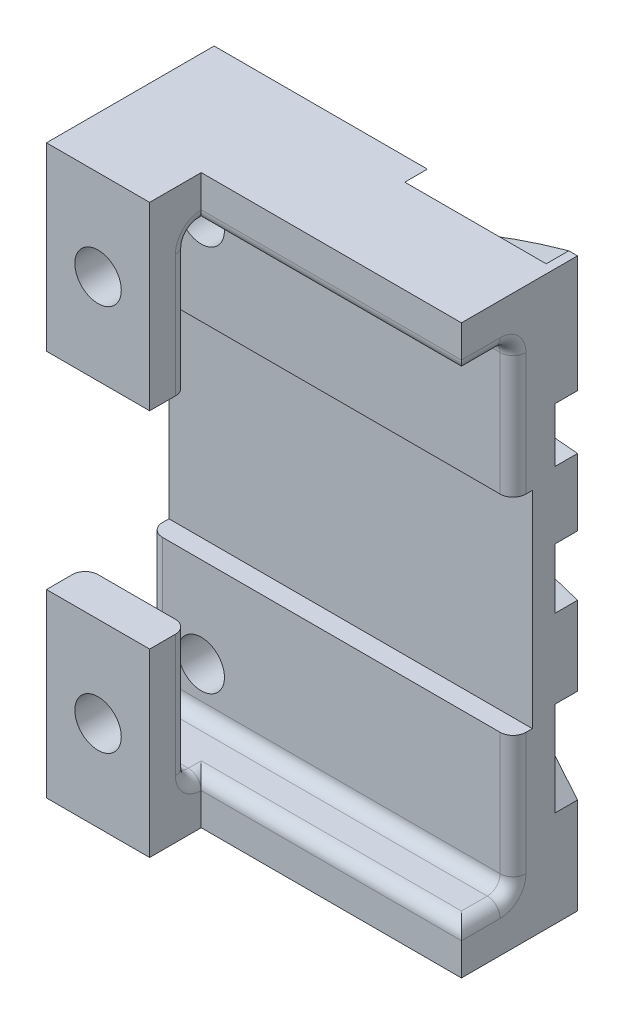
from build123d import *

# Parameters (mm, degrees)
BOSS_EXTRUDE1_DEPTH      = 11
BOSS_EXTRUDE1_DEPTH_BACK = 2
SKETCH1_W                = 28.18
SKETCH1_H                = 44
CUT_EXTRUDE1_DEPTH       = 37
SKETCH4_W                = 20.18
SKETCH4_H                = 4
CUT_EXTRUDE2_DEPTH       = 48
CUT_EXTRUDE3_DEPTH       = 1.75
SKETCH7_R                = 1.8
CUT_EXTRUDE4_DEPTH       = 23
FILLET1_R                = 1
SKETCH8_R                = 3.25
CUT_EXTRUDE5_DEPTH       = 1.75


with BuildPart() as part:
    # Sketch1 → Boss-Extrude1 (new, two sides: drawn at the far end of the back side and taken through both)
    with BuildSketch(Plane.XY.offset(-BOSS_EXTRUDE1_DEPTH_BACK)):
        Rectangle(SKETCH1_W, SKETCH1_H)
    extrude(amount=BOSS_EXTRUDE1_DEPTH + BOSS_EXTRUDE1_DEPTH_BACK)

    # Sketch3 → Cut-Extrude1 (cut)
    with BuildSketch(Plane.ZY.offset(14.09)):
        Polygon((8, 8), (11, 8), (11, -8), (8, -8), (8, -18.5), (3, -18.5), (3, -8), (1.5033938, -8), (1.5033938, 8), (3, 8), (3, 18.5), (8, 18.5), align=None)
    extrude(amount=-CUT_EXTRUDE1_DEPTH, mode=Mode.SUBTRACT)

    # Sketch4 → Cut-Extrude2 (cut)
    with BuildSketch(Plane.XZ.offset(22)):
        with Locations((4, 9)):
            Rectangle(SKETCH4_W, SKETCH4_H)
    extrude(amount=-CUT_EXTRUDE2_DEPTH, mode=Mode.SUBTRACT)

    # Sketch5 → Cut-Extrude3 (cut)
    with BuildSketch(Plane(origin=(0, 0, -2), x_dir=(-1, 0, 0), z_dir=(0, 0, -1))):
        with BuildLine():
            Line((-9.422350513, -22), (-5.513274624, -22))
            add(Edge.make_bspline(
                [(-14.09, 12.943541527), (17.027152303, 14.230895657), (-0.913223026, -5.637747584), (-5.513274624, -22)],
                knots=[0, 0, 0, 0, 0.88215351, 0.88215351, 0.88215351, 0.88215351], degree=3))
            Line((-14.09, 12.943541527), (-14.09, 8.727219843))
            add(Edge.make_bspline(
                [(-14.09, 8.727219843), (12.710361443, 11.678555955), (-5.250487577, -7.026945605), (-9.422350513, -22)],
                knots=[0, 0, 0, 0, 0.871233208, 0.871233208, 0.871233208, 0.871233208], degree=3))
        make_face()
        with BuildLine():
            add(Edge.make_bspline(
                [(-14.09, 3.523280295), (7.913446573, 11.6376574), (-14.09, -14.545652593)],
                knots=[0, 0, 0, 1, 1, 1], degree=2))
            Line((-14.09, 3.523280295), (-14.09, -1.131328535))
            add(Edge.make_bspline(
                [(-14.09, -1.131328535), (-1.654052468, 3.211926994), (-14.09, -7.240502624)],
                knots=[0, 0, 0, 1, 1, 1], degree=2))
            Line((-14.09, -7.240502624), (-14.09, -14.545652593))
        make_face()
        with BuildLine():
            add(Edge.make_bspline(
                [(-2.448223174, 22), (19.56705897, 11.536361781), (5.151599528, -7.62224079), (5.592236917, -22)],
                knots=[0, 0, 0, 0, 0.832841206, 0.832841206, 0.832841206, 0.832841206], degree=3))
            Line((-2.448223174, 22), (-13.413117725, 22))
            add(Edge.make_bspline(
                [(-13.413117725, 22), (18.496116363, 13.047461166), (3.546154763, -4.863207343), (0.001206333, -22)],
                knots=[0, 0, 0, 0, 0.886771983, 0.886771983, 0.886771983, 0.886771983], degree=3))
            Line((0.001206333, -22), (5.592236917, -22))
        make_face()
    extrude(amount=-CUT_EXTRUDE3_DEPTH, mode=Mode.SUBTRACT)

    # Sketch7 → Cut-Extrude4 (cut)
    with BuildSketch(Plane.XY.offset(11)):
        with Locations((-10.09, 15)):
            Circle(SKETCH7_R)
        with Locations((-10.09, -15)):
            Circle(SKETCH7_R)
    extrude(amount=-CUT_EXTRUDE4_DEPTH, mode=Mode.SUBTRACT)

    # Fillet1
    fillet1_edges = [part.edges().sort_by_distance(p)[0] for p in [
        (-14.09, -13.25, 3),
        (-14.09, -13.25, 8),
        (14.09, -13.25, 3),
        (-6.09, -13.25, 8),
        (14.09, 13.25, 3),
        (-14.09, 13.25, 3),
        (-14.09, 13.25, 8),
        (-6.09, 13.25, 8),
        (-14.09, -18.5, 5.5),
        (0, -18.5, 3),
        (14.09, -18.5, 5),
        (4, -18.5, 7),
        (-6.09, -18.5, 7.5),
        (-10.09, -18.5, 8),
        (14.09, 18.5, 5),
        (0, 18.5, 3),
        (-14.09, 18.5, 5.5),
        (-10.09, 18.5, 8),
        (-6.09, 18.5, 7.5),
        (4, 18.5, 7),
    ]]
    fillet(fillet1_edges, radius=FILLET1_R - 0.0001)  # a hair under: the kernel refuses the full size

    # Sketch8 → Cut-Extrude5 (cut)
    with BuildSketch(Plane(origin=(0, 0, -2), x_dir=(-1, 0, 0), z_dir=(0, 0, -1))):
        with Locations((10.09, -15)):
            Circle(SKETCH8_R)
        with Locations((10.09, 15)):
            Circle(SKETCH8_R)
    extrude(amount=-CUT_EXTRUDE5_DEPTH, mode=Mode.SUBTRACT)


solid = part.part
